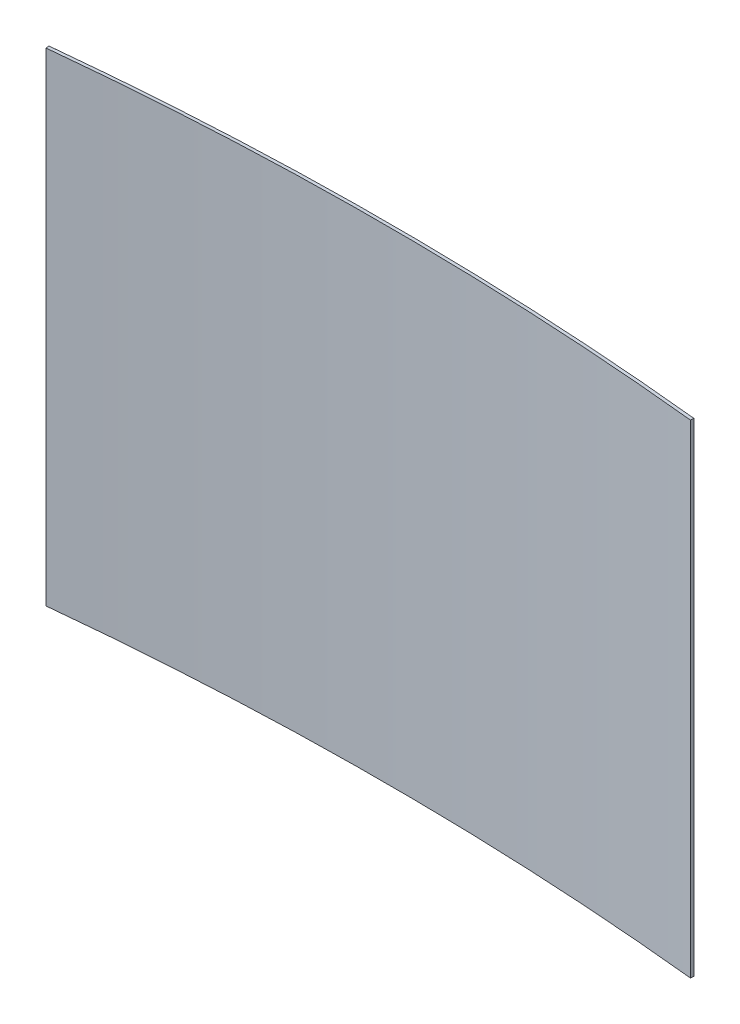
from build123d import *

# Parameters (mm, degrees)
SM_BASE_FLANGE_1_DEPTH = 75


# Sheet-metal steps are written as plain solids
with BuildPart() as part:
    # Sketch 1 → 基体-法兰1 (new, symmetric)
    with BuildSketch(Plane(origin=(0, 0, 0), x_dir=(1, 0, 0), z_dir=(0, 1, 0))):
        with BuildLine():
            ThreePointArc((100, 972.3714568), (0, 977.5), (-100, 972.3714568))
            Line((-100, 972.3714568), (-100.10230179, 973.366210209))
            ThreePointArc((-100.10230179, 973.366210209), (0, 978.5), (100.10230179, 973.366210209))
            Line((100.10230179, 973.366210209), (100, 972.3714568))
        make_face()
    extrude(amount=SM_BASE_FLANGE_1_DEPTH, both=True)


solid = part.part
